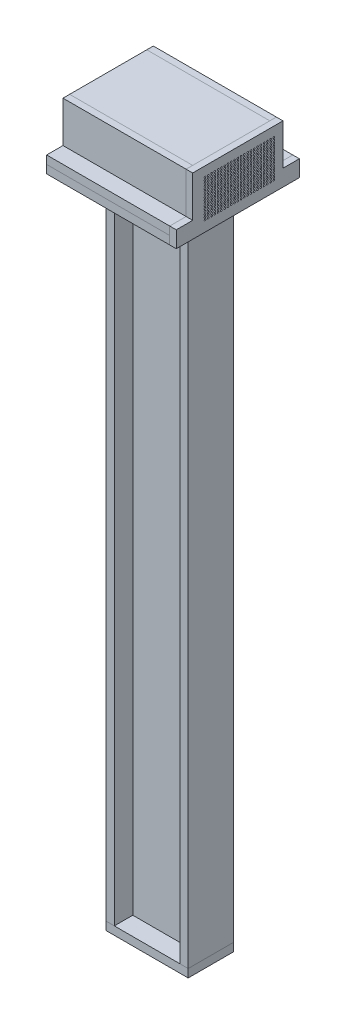
from build123d import *

# Parameters (mm, degrees)
SKETCH1_W             = 100
SKETCH1_H             = 55
BOSS_EXTRUDE1_DEPTH   = 10
BOSS_EXTRUDE2_DEPTH   = 800
SKETCH3_W             = 150
SKETCH3_H             = 150
BOSS_EXTRUDE3_DEPTH   = 10
SKETCH4_W             = 150
SKETCH4_H             = 20
BOSS_EXTRUDE4_DEPTH   = 10
BOSS_EXTRUDE4_2_DEPTH = 10
SKETCH5_W             = 150
SKETCH5_H             = 8
BOSS_EXTRUDE5_DEPTH   = 60
BOSS_EXTRUDE5_2_DEPTH = 60
BOSS_EXTRUDE6_REACH   = 899.167
SKETCH6_W             = 150
SKETCH6_H             = 8
BOSS_EXTRUDE7_DEPTH   = 8
BOSS_EXTRUDE8_DEPTH   = 94
SKETCH8_R             = 1
CUT_EXTRUDE2_DEPTH    = 8
SKETCH11_R            = 17.5
BOSS_EXTRUDE9_DEPTH   = 10
SKETCH12_R            = 15.5
CUT_EXTRUDE3_DEPTH    = 40


with BuildPart() as part:
    # Sketch1 → Boss-Extrude1 (new body)
    with BuildSketch(Plane(origin=(0, 0, 0), x_dir=(1, 0, 0), z_dir=(0, 1, 0))):
        with Locations((50, 27.5)):
            Rectangle(SKETCH1_W, SKETCH1_H)
    extrude(amount=BOSS_EXTRUDE1_DEPTH)


with BuildPart() as body_2:
    # Sketch2 → Boss-Extrude2 (new body)
    with BuildSketch(Plane(origin=(0, 10, 0), x_dir=(1, 0, 0), z_dir=(0, 1, 0))):
        Polygon((10, 55), (10, 32.5), (90, 32.5), (90, 55), (100, 55), (100, 0), (90, 0), (90, 22.5), (10, 22.5), (10, 0), (0, 0), (0, 55), align=None)
    extrude(amount=BOSS_EXTRUDE2_DEPTH)


with BuildPart() as body_3:
    # Sketch3 → Boss-Extrude3 (new body)
    with BuildSketch(Plane(origin=(0, 810, 0), x_dir=(1, 0, 0), z_dir=(0, 1, 0))):
        with Locations((50, 27.5)):
            Rectangle(SKETCH3_W, SKETCH3_H)
    extrude(amount=BOSS_EXTRUDE3_DEPTH)


with BuildPart() as body_4:
    # Sketch4 → Boss-Extrude4 (new body)
    with BuildSketch(Plane(origin=(0, 820, 0), x_dir=(1, 0, 0), z_dir=(0, 1, 0))):
        with Locations((50, 92.5)):
            Rectangle(SKETCH4_W, SKETCH4_H)
    extrude(amount=BOSS_EXTRUDE4_DEPTH)


with BuildPart() as body_5:
    # Sketch4 → Boss-Extrude4 2 (new body)
    with BuildSketch(Plane(origin=(0, 820, 0), x_dir=(1, 0, 0), z_dir=(0, 1, 0))):
        with Locations((50, -37.5)):
            Rectangle(SKETCH4_W, SKETCH4_H)
    extrude(amount=BOSS_EXTRUDE4_2_DEPTH)


with BuildPart() as body_6:
    # Sketch5 → Boss-Extrude5 (new body)
    with BuildSketch(Plane(origin=(0, 820, 0), x_dir=(1, 0, 0), z_dir=(0, 1, 0))):
        with Locations((50, 78.5)):
            Rectangle(SKETCH5_W, SKETCH5_H)
    extrude(amount=BOSS_EXTRUDE5_DEPTH)


with BuildPart() as body_7:
    # Sketch5 → Boss-Extrude5 2 (new body)
    with BuildSketch(Plane(origin=(0, 820, 0), x_dir=(1, 0, 0), z_dir=(0, 1, 0))):
        Polygon((-25, -19.5), (125, -19.5), (125, -27.5), (-25, -27.620297827), align=None)
    extrude(amount=BOSS_EXTRUDE5_2_DEPTH)


with BuildPart() as body_8:

    # Sketch6 → Boss-Extrude6 (new, up to next)
    with BuildSketch(Plane.XY.offset(-74.5), mode=Mode.PRIVATE) as boss_extrude6_sk1:
        with Locations((50, 876)):
            Rectangle(SKETCH6_W, SKETCH6_H)
    boss_extrude6_tool1 = extrude(boss_extrude6_sk1.sketch, amount=BOSS_EXTRUDE6_REACH, mode=Mode.PRIVATE) - body_7.part
    add(boss_extrude6_tool1.solids().sort_by_distance((50, 876, -74.5))[0])


with BuildPart() as body_9:
    # Sketch7 → Boss-Extrude7 (new body)
    with BuildSketch(Plane(origin=(125, 0, 0), x_dir=(0, 0, -1), z_dir=(1, 0, 0))):
        Polygon((-47.5, 810), (-47.5, 830), (-27.5, 830), (-27.5, 880), (82.5, 880), (82.5, 830), (102.5, 830), (102.5, 810), align=None)
    extrude(amount=BOSS_EXTRUDE7_DEPTH)

    # Sketch8 → Cut-Extrude2 (cut)
    with BuildSketch(Plane(origin=(133, 0, 0), x_dir=(0, 0, -1), z_dir=(1, 0, 0))):
        with Locations((-12.5, 868)):
            Circle(SKETCH8_R)
        with Locations((-8.5, 868)):
            Circle(SKETCH8_R)
        with Locations((-4.5, 868)):
            Circle(SKETCH8_R)
        with Locations((-0.5, 868)):
            Circle(SKETCH8_R)
        with Locations((3.5, 868)):
            Circle(SKETCH8_R)
        with Locations((7.5, 868)):
            Circle(SKETCH8_R)
        with Locations((11.5, 868)):
            Circle(SKETCH8_R)
        with Locations((15.5, 868)):
            Circle(SKETCH8_R)
        with Locations((19.5, 868)):
            Circle(SKETCH8_R)
        with Locations((23.5, 868)):
            Circle(SKETCH8_R)
        with Locations((27.5, 868)):
            Circle(SKETCH8_R)
        with Locations((31.5, 868)):
            Circle(SKETCH8_R)
        with Locations((35.5, 868)):
            Circle(SKETCH8_R)
        with Locations((39.5, 868)):
            Circle(SKETCH8_R)
        with Locations((43.5, 868)):
            Circle(SKETCH8_R)
        with Locations((47.5, 868)):
            Circle(SKETCH8_R)
        with Locations((51.5, 868)):
            Circle(SKETCH8_R)
        with Locations((55.5, 868)):
            Circle(SKETCH8_R)
        with Locations((59.5, 868)):
            Circle(SKETCH8_R)
        with Locations((63.5, 868)):
            Circle(SKETCH8_R)
        with Locations((67.5, 868)):
            Circle(SKETCH8_R)
        with Locations((71.5, 868)):
            Circle(SKETCH8_R)
        with Locations((-8.5, 865)):
            Circle(SKETCH8_R)
        with Locations((-4.5, 865)):
            Circle(SKETCH8_R)
        with Locations((-0.5, 865)):
            Circle(SKETCH8_R)
        with Locations((3.5, 865)):
            Circle(SKETCH8_R)
        with Locations((7.5, 865)):
            Circle(SKETCH8_R)
        with Locations((11.5, 865)):
            Circle(SKETCH8_R)
        with Locations((15.5, 865)):
            Circle(SKETCH8_R)
        with Locations((19.5, 865)):
            Circle(SKETCH8_R)
        with Locations((23.5, 865)):
            Circle(SKETCH8_R)
        with Locations((27.5, 865)):
            Circle(SKETCH8_R)
        with Locations((31.5, 865)):
            Circle(SKETCH8_R)
        with Locations((35.5, 865)):
            Circle(SKETCH8_R)
        with Locations((39.5, 865)):
            Circle(SKETCH8_R)
        with Locations((43.5, 865)):
            Circle(SKETCH8_R)
        with Locations((47.5, 865)):
            Circle(SKETCH8_R)
        with Locations((51.5, 865)):
            Circle(SKETCH8_R)
        with Locations((55.5, 865)):
            Circle(SKETCH8_R)
        with Locations((59.5, 865)):
            Circle(SKETCH8_R)
        with Locations((63.5, 865)):
            Circle(SKETCH8_R)
        with Locations((67.5, 865)):
            Circle(SKETCH8_R)
        with Locations((71.5, 865)):
            Circle(SKETCH8_R)
        with Locations((-8.5, 862)):
            Circle(SKETCH8_R)
        with Locations((-4.5, 862)):
            Circle(SKETCH8_R)
        with Locations((-0.5, 862)):
            Circle(SKETCH8_R)
        with Locations((3.5, 862)):
            Circle(SKETCH8_R)
        with Locations((7.5, 862)):
            Circle(SKETCH8_R)
        with Locations((11.5, 862)):
            Circle(SKETCH8_R)
        with Locations((15.5, 862)):
            Circle(SKETCH8_R)
        with Locations((19.5, 862)):
            Circle(SKETCH8_R)
        with Locations((23.5, 862)):
            Circle(SKETCH8_R)
        with Locations((27.5, 862)):
            Circle(SKETCH8_R)
        with Locations((31.5, 862)):
            Circle(SKETCH8_R)
        with Locations((35.5, 862)):
            Circle(SKETCH8_R)
        with Locations((39.5, 862)):
            Circle(SKETCH8_R)
        with Locations((43.5, 862)):
            Circle(SKETCH8_R)
        with Locations((47.5, 862)):
            Circle(SKETCH8_R)
        with Locations((51.5, 862)):
            Circle(SKETCH8_R)
        with Locations((55.5, 862)):
            Circle(SKETCH8_R)
        with Locations((59.5, 862)):
            Circle(SKETCH8_R)
        with Locations((63.5, 862)):
            Circle(SKETCH8_R)
        with Locations((67.5, 862)):
            Circle(SKETCH8_R)
        with Locations((71.5, 862)):
            Circle(SKETCH8_R)
        with Locations((-8.5, 859)):
            Circle(SKETCH8_R)
        with Locations((-4.5, 859)):
            Circle(SKETCH8_R)
        with Locations((-0.5, 859)):
            Circle(SKETCH8_R)
        with Locations((3.5, 859)):
            Circle(SKETCH8_R)
        with Locations((7.5, 859)):
            Circle(SKETCH8_R)
        with Locations((11.5, 859)):
            Circle(SKETCH8_R)
        with Locations((15.5, 859)):
            Circle(SKETCH8_R)
        with Locations((19.5, 859)):
            Circle(SKETCH8_R)
        with Locations((23.5, 859)):
            Circle(SKETCH8_R)
        with Locations((27.5, 859)):
            Circle(SKETCH8_R)
        with Locations((31.5, 859)):
            Circle(SKETCH8_R)
        with Locations((35.5, 859)):
            Circle(SKETCH8_R)
        with Locations((39.5, 859)):
            Circle(SKETCH8_R)
        with Locations((43.5, 859)):
            Circle(SKETCH8_R)
        with Locations((47.5, 859)):
            Circle(SKETCH8_R)
        with Locations((51.5, 859)):
            Circle(SKETCH8_R)
        with Locations((55.5, 859)):
            Circle(SKETCH8_R)
        with Locations((59.5, 859)):
            Circle(SKETCH8_R)
        with Locations((63.5, 859)):
            Circle(SKETCH8_R)
        with Locations((67.5, 859)):
            Circle(SKETCH8_R)
        with Locations((71.5, 859)):
            Circle(SKETCH8_R)
        with Locations((-8.5, 856)):
            Circle(SKETCH8_R)
        with Locations((-4.5, 856)):
            Circle(SKETCH8_R)
        with Locations((-0.5, 856)):
            Circle(SKETCH8_R)
        with Locations((3.5, 856)):
            Circle(SKETCH8_R)
        with Locations((7.5, 856)):
            Circle(SKETCH8_R)
        with Locations((11.5, 856)):
            Circle(SKETCH8_R)
        with Locations((15.5, 856)):
            Circle(SKETCH8_R)
        with Locations((19.5, 856)):
            Circle(SKETCH8_R)
        with Locations((23.5, 856)):
            Circle(SKETCH8_R)
        with Locations((27.5, 856)):
            Circle(SKETCH8_R)
        with Locations((31.5, 856)):
            Circle(SKETCH8_R)
        with Locations((35.5, 856)):
            Circle(SKETCH8_R)
        with Locations((39.5, 856)):
            Circle(SKETCH8_R)
        with Locations((43.5, 856)):
            Circle(SKETCH8_R)
        with Locations((47.5, 856)):
            Circle(SKETCH8_R)
        with Locations((51.5, 856)):
            Circle(SKETCH8_R)
        with Locations((55.5, 856)):
            Circle(SKETCH8_R)
        with Locations((59.5, 856)):
            Circle(SKETCH8_R)
        with Locations((63.5, 856)):
            Circle(SKETCH8_R)
        with Locations((67.5, 856)):
            Circle(SKETCH8_R)
        with Locations((71.5, 856)):
            Circle(SKETCH8_R)
        with Locations((-8.5, 853)):
            Circle(SKETCH8_R)
        with Locations((-4.5, 853)):
            Circle(SKETCH8_R)
        with Locations((-0.5, 853)):
            Circle(SKETCH8_R)
        with Locations((3.5, 853)):
            Circle(SKETCH8_R)
        with Locations((7.5, 853)):
            Circle(SKETCH8_R)
        with Locations((11.5, 853)):
            Circle(SKETCH8_R)
        with Locations((15.5, 853)):
            Circle(SKETCH8_R)
        with Locations((19.5, 853)):
            Circle(SKETCH8_R)
        with Locations((23.5, 853)):
            Circle(SKETCH8_R)
        with Locations((27.5, 853)):
            Circle(SKETCH8_R)
        with Locations((31.5, 853)):
            Circle(SKETCH8_R)
        with Locations((35.5, 853)):
            Circle(SKETCH8_R)
        with Locations((39.5, 853)):
            Circle(SKETCH8_R)
        with Locations((43.5, 853)):
            Circle(SKETCH8_R)
        with Locations((47.5, 853)):
            Circle(SKETCH8_R)
        with Locations((51.5, 853)):
            Circle(SKETCH8_R)
        with Locations((55.5, 853)):
            Circle(SKETCH8_R)
        with Locations((59.5, 853)):
            Circle(SKETCH8_R)
        with Locations((63.5, 853)):
            Circle(SKETCH8_R)
        with Locations((67.5, 853)):
            Circle(SKETCH8_R)
        with Locations((71.5, 853)):
            Circle(SKETCH8_R)
        with Locations((-8.5, 850)):
            Circle(SKETCH8_R)
        with Locations((-4.5, 850)):
            Circle(SKETCH8_R)
        with Locations((-0.5, 850)):
            Circle(SKETCH8_R)
        with Locations((3.5, 850)):
            Circle(SKETCH8_R)
        with Locations((7.5, 850)):
            Circle(SKETCH8_R)
        with Locations((11.5, 850)):
            Circle(SKETCH8_R)
        with Locations((15.5, 850)):
            Circle(SKETCH8_R)
        with Locations((19.5, 850)):
            Circle(SKETCH8_R)
        with Locations((23.5, 850)):
            Circle(SKETCH8_R)
        with Locations((27.5, 850)):
            Circle(SKETCH8_R)
        with Locations((31.5, 850)):
            Circle(SKETCH8_R)
        with Locations((35.5, 850)):
            Circle(SKETCH8_R)
        with Locations((39.5, 850)):
            Circle(SKETCH8_R)
        with Locations((43.5, 850)):
            Circle(SKETCH8_R)
        with Locations((47.5, 850)):
            Circle(SKETCH8_R)
        with Locations((51.5, 850)):
            Circle(SKETCH8_R)
        with Locations((55.5, 850)):
            Circle(SKETCH8_R)
        with Locations((59.5, 850)):
            Circle(SKETCH8_R)
        with Locations((63.5, 850)):
            Circle(SKETCH8_R)
        with Locations((67.5, 850)):
            Circle(SKETCH8_R)
        with Locations((71.5, 850)):
            Circle(SKETCH8_R)
        with Locations((-8.5, 847)):
            Circle(SKETCH8_R)
        with Locations((-4.5, 847)):
            Circle(SKETCH8_R)
        with Locations((-0.5, 847)):
            Circle(SKETCH8_R)
        with Locations((3.5, 847)):
            Circle(SKETCH8_R)
        with Locations((7.5, 847)):
            Circle(SKETCH8_R)
        with Locations((11.5, 847)):
            Circle(SKETCH8_R)
        with Locations((15.5, 847)):
            Circle(SKETCH8_R)
        with Locations((19.5, 847)):
            Circle(SKETCH8_R)
        with Locations((23.5, 847)):
            Circle(SKETCH8_R)
        with Locations((27.5, 847)):
            Circle(SKETCH8_R)
        with Locations((31.5, 847)):
            Circle(SKETCH8_R)
        with Locations((35.5, 847)):
            Circle(SKETCH8_R)
        with Locations((39.5, 847)):
            Circle(SKETCH8_R)
        with Locations((43.5, 847)):
            Circle(SKETCH8_R)
        with Locations((47.5, 847)):
            Circle(SKETCH8_R)
        with Locations((51.5, 847)):
            Circle(SKETCH8_R)
        with Locations((55.5, 847)):
            Circle(SKETCH8_R)
        with Locations((59.5, 847)):
            Circle(SKETCH8_R)
        with Locations((63.5, 847)):
            Circle(SKETCH8_R)
        with Locations((67.5, 847)):
            Circle(SKETCH8_R)
        with Locations((71.5, 847)):
            Circle(SKETCH8_R)
        with Locations((-8.5, 844)):
            Circle(SKETCH8_R)
        with Locations((-4.5, 844)):
            Circle(SKETCH8_R)
        with Locations((-0.5, 844)):
            Circle(SKETCH8_R)
        with Locations((3.5, 844)):
            Circle(SKETCH8_R)
        with Locations((7.5, 844)):
            Circle(SKETCH8_R)
        with Locations((11.5, 844)):
            Circle(SKETCH8_R)
        with Locations((15.5, 844)):
            Circle(SKETCH8_R)
        with Locations((19.5, 844)):
            Circle(SKETCH8_R)
        with Locations((23.5, 844)):
            Circle(SKETCH8_R)
        with Locations((27.5, 844)):
            Circle(SKETCH8_R)
        with Locations((31.5, 844)):
            Circle(SKETCH8_R)
        with Locations((35.5, 844)):
            Circle(SKETCH8_R)
        with Locations((39.5, 844)):
            Circle(SKETCH8_R)
        with Locations((43.5, 844)):
            Circle(SKETCH8_R)
        with Locations((47.5, 844)):
            Circle(SKETCH8_R)
        with Locations((51.5, 844)):
            Circle(SKETCH8_R)
        with Locations((55.5, 844)):
            Circle(SKETCH8_R)
        with Locations((59.5, 844)):
            Circle(SKETCH8_R)
        with Locations((63.5, 844)):
            Circle(SKETCH8_R)
        with Locations((67.5, 844)):
            Circle(SKETCH8_R)
        with Locations((71.5, 844)):
            Circle(SKETCH8_R)
        with Locations((-8.5, 841)):
            Circle(SKETCH8_R)
        with Locations((-4.5, 841)):
            Circle(SKETCH8_R)
        with Locations((-0.5, 841)):
            Circle(SKETCH8_R)
        with Locations((3.5, 841)):
            Circle(SKETCH8_R)
        with Locations((7.5, 841)):
            Circle(SKETCH8_R)
        with Locations((11.5, 841)):
            Circle(SKETCH8_R)
        with Locations((15.5, 841)):
            Circle(SKETCH8_R)
        with Locations((19.5, 841)):
            Circle(SKETCH8_R)
        with Locations((23.5, 841)):
            Circle(SKETCH8_R)
        with Locations((27.5, 841)):
            Circle(SKETCH8_R)
        with Locations((31.5, 841)):
            Circle(SKETCH8_R)
        with Locations((35.5, 841)):
            Circle(SKETCH8_R)
        with Locations((39.5, 841)):
            Circle(SKETCH8_R)
        with Locations((43.5, 841)):
            Circle(SKETCH8_R)
        with Locations((47.5, 841)):
            Circle(SKETCH8_R)
        with Locations((51.5, 841)):
            Circle(SKETCH8_R)
        with Locations((55.5, 841)):
            Circle(SKETCH8_R)
        with Locations((59.5, 841)):
            Circle(SKETCH8_R)
        with Locations((63.5, 841)):
            Circle(SKETCH8_R)
        with Locations((67.5, 841)):
            Circle(SKETCH8_R)
        with Locations((71.5, 841)):
            Circle(SKETCH8_R)
        with Locations((-8.5, 838)):
            Circle(SKETCH8_R)
        with Locations((-4.5, 838)):
            Circle(SKETCH8_R)
        with Locations((-0.5, 838)):
            Circle(SKETCH8_R)
        with Locations((3.5, 838)):
            Circle(SKETCH8_R)
        with Locations((7.5, 838)):
            Circle(SKETCH8_R)
        with Locations((11.5, 838)):
            Circle(SKETCH8_R)
        with Locations((15.5, 838)):
            Circle(SKETCH8_R)
        with Locations((19.5, 838)):
            Circle(SKETCH8_R)
        with Locations((23.5, 838)):
            Circle(SKETCH8_R)
        with Locations((27.5, 838)):
            Circle(SKETCH8_R)
        with Locations((31.5, 838)):
            Circle(SKETCH8_R)
        with Locations((35.5, 838)):
            Circle(SKETCH8_R)
        with Locations((39.5, 838)):
            Circle(SKETCH8_R)
        with Locations((43.5, 838)):
            Circle(SKETCH8_R)
        with Locations((47.5, 838)):
            Circle(SKETCH8_R)
        with Locations((51.5, 838)):
            Circle(SKETCH8_R)
        with Locations((55.5, 838)):
            Circle(SKETCH8_R)
        with Locations((59.5, 838)):
            Circle(SKETCH8_R)
        with Locations((63.5, 838)):
            Circle(SKETCH8_R)
        with Locations((67.5, 838)):
            Circle(SKETCH8_R)
        with Locations((71.5, 838)):
            Circle(SKETCH8_R)
        with Locations((-8.5, 835)):
            Circle(SKETCH8_R)
        with Locations((-4.5, 835)):
            Circle(SKETCH8_R)
        with Locations((-0.5, 835)):
            Circle(SKETCH8_R)
        with Locations((3.5, 835)):
            Circle(SKETCH8_R)
        with Locations((7.5, 835)):
            Circle(SKETCH8_R)
        with Locations((11.5, 835)):
            Circle(SKETCH8_R)
        with Locations((15.5, 835)):
            Circle(SKETCH8_R)
        with Locations((19.5, 835)):
            Circle(SKETCH8_R)
        with Locations((23.5, 835)):
            Circle(SKETCH8_R)
        with Locations((27.5, 835)):
            Circle(SKETCH8_R)
        with Locations((31.5, 835)):
            Circle(SKETCH8_R)
        with Locations((35.5, 835)):
            Circle(SKETCH8_R)
        with Locations((39.5, 835)):
            Circle(SKETCH8_R)
        with Locations((43.5, 835)):
            Circle(SKETCH8_R)
        with Locations((47.5, 835)):
            Circle(SKETCH8_R)
        with Locations((51.5, 835)):
            Circle(SKETCH8_R)
        with Locations((55.5, 835)):
            Circle(SKETCH8_R)
        with Locations((59.5, 835)):
            Circle(SKETCH8_R)
        with Locations((63.5, 835)):
            Circle(SKETCH8_R)
        with Locations((67.5, 835)):
            Circle(SKETCH8_R)
        with Locations((71.5, 835)):
            Circle(SKETCH8_R)
        with Locations((-8.5, 832)):
            Circle(SKETCH8_R)
        with Locations((-4.5, 832)):
            Circle(SKETCH8_R)
        with Locations((-0.5, 832)):
            Circle(SKETCH8_R)
        with Locations((3.5, 832)):
            Circle(SKETCH8_R)
        with Locations((7.5, 832)):
            Circle(SKETCH8_R)
        with Locations((11.5, 832)):
            Circle(SKETCH8_R)
        with Locations((15.5, 832)):
            Circle(SKETCH8_R)
        with Locations((19.5, 832)):
            Circle(SKETCH8_R)
        with Locations((23.5, 832)):
            Circle(SKETCH8_R)
        with Locations((27.5, 832)):
            Circle(SKETCH8_R)
        with Locations((31.5, 832)):
            Circle(SKETCH8_R)
        with Locations((35.5, 832)):
            Circle(SKETCH8_R)
        with Locations((39.5, 832)):
            Circle(SKETCH8_R)
        with Locations((43.5, 832)):
            Circle(SKETCH8_R)
        with Locations((47.5, 832)):
            Circle(SKETCH8_R)
        with Locations((51.5, 832)):
            Circle(SKETCH8_R)
        with Locations((55.5, 832)):
            Circle(SKETCH8_R)
        with Locations((59.5, 832)):
            Circle(SKETCH8_R)
        with Locations((63.5, 832)):
            Circle(SKETCH8_R)
        with Locations((67.5, 832)):
            Circle(SKETCH8_R)
        with Locations((71.5, 832)):
            Circle(SKETCH8_R)
        with Locations((-8.5, 829)):
            Circle(SKETCH8_R)
        with Locations((-4.5, 829)):
            Circle(SKETCH8_R)
        with Locations((-0.5, 829)):
            Circle(SKETCH8_R)
        with Locations((3.5, 829)):
            Circle(SKETCH8_R)
        with Locations((7.5, 829)):
            Circle(SKETCH8_R)
        with Locations((11.5, 829)):
            Circle(SKETCH8_R)
        with Locations((15.5, 829)):
            Circle(SKETCH8_R)
        with Locations((19.5, 829)):
            Circle(SKETCH8_R)
        with Locations((23.5, 829)):
            Circle(SKETCH8_R)
        with Locations((27.5, 829)):
            Circle(SKETCH8_R)
        with Locations((31.5, 829)):
            Circle(SKETCH8_R)
        with Locations((35.5, 829)):
            Circle(SKETCH8_R)
        with Locations((39.5, 829)):
            Circle(SKETCH8_R)
        with Locations((43.5, 829)):
            Circle(SKETCH8_R)
        with Locations((47.5, 829)):
            Circle(SKETCH8_R)
        with Locations((51.5, 829)):
            Circle(SKETCH8_R)
        with Locations((55.5, 829)):
            Circle(SKETCH8_R)
        with Locations((59.5, 829)):
            Circle(SKETCH8_R)
        with Locations((63.5, 829)):
            Circle(SKETCH8_R)
        with Locations((67.5, 829)):
            Circle(SKETCH8_R)
        with Locations((71.5, 829)):
            Circle(SKETCH8_R)
        with Locations((-8.5, 826)):
            Circle(SKETCH8_R)
        with Locations((-4.5, 826)):
            Circle(SKETCH8_R)
        with Locations((-0.5, 826)):
            Circle(SKETCH8_R)
        with Locations((3.5, 826)):
            Circle(SKETCH8_R)
        with Locations((7.5, 826)):
            Circle(SKETCH8_R)
        with Locations((11.5, 826)):
            Circle(SKETCH8_R)
        with Locations((15.5, 826)):
            Circle(SKETCH8_R)
        with Locations((19.5, 826)):
            Circle(SKETCH8_R)
        with Locations((23.5, 826)):
            Circle(SKETCH8_R)
        with Locations((27.5, 826)):
            Circle(SKETCH8_R)
        with Locations((31.5, 826)):
            Circle(SKETCH8_R)
        with Locations((35.5, 826)):
            Circle(SKETCH8_R)
        with Locations((39.5, 826)):
            Circle(SKETCH8_R)
        with Locations((43.5, 826)):
            Circle(SKETCH8_R)
        with Locations((47.5, 826)):
            Circle(SKETCH8_R)
        with Locations((51.5, 826)):
            Circle(SKETCH8_R)
        with Locations((55.5, 826)):
            Circle(SKETCH8_R)
        with Locations((59.5, 826)):
            Circle(SKETCH8_R)
        with Locations((63.5, 826)):
            Circle(SKETCH8_R)
        with Locations((67.5, 826)):
            Circle(SKETCH8_R)
        with Locations((71.5, 826)):
            Circle(SKETCH8_R)
        with Locations((-8.5, 823)):
            Circle(SKETCH8_R)
        with Locations((-4.5, 823)):
            Circle(SKETCH8_R)
        with Locations((-0.5, 823)):
            Circle(SKETCH8_R)
        with Locations((3.5, 823)):
            Circle(SKETCH8_R)
        with Locations((7.5, 823)):
            Circle(SKETCH8_R)
        with Locations((11.5, 823)):
            Circle(SKETCH8_R)
        with Locations((15.5, 823)):
            Circle(SKETCH8_R)
        with Locations((19.5, 823)):
            Circle(SKETCH8_R)
        with Locations((23.5, 823)):
            Circle(SKETCH8_R)
        with Locations((27.5, 823)):
            Circle(SKETCH8_R)
        with Locations((31.5, 823)):
            Circle(SKETCH8_R)
        with Locations((35.5, 823)):
            Circle(SKETCH8_R)
        with Locations((39.5, 823)):
            Circle(SKETCH8_R)
        with Locations((43.5, 823)):
            Circle(SKETCH8_R)
        with Locations((47.5, 823)):
            Circle(SKETCH8_R)
        with Locations((51.5, 823)):
            Circle(SKETCH8_R)
        with Locations((55.5, 823)):
            Circle(SKETCH8_R)
        with Locations((59.5, 823)):
            Circle(SKETCH8_R)
        with Locations((63.5, 823)):
            Circle(SKETCH8_R)
        with Locations((67.5, 823)):
            Circle(SKETCH8_R)
        with Locations((71.5, 823)):
            Circle(SKETCH8_R)
        with Locations((-12.5, 865)):
            Circle(SKETCH8_R)
        with Locations((-12.5, 862)):
            Circle(SKETCH8_R)
        with Locations((-12.5, 859)):
            Circle(SKETCH8_R)
        with Locations((-12.5, 856)):
            Circle(SKETCH8_R)
        with Locations((-12.5, 853)):
            Circle(SKETCH8_R)
        with Locations((-12.5, 850)):
            Circle(SKETCH8_R)
        with Locations((-12.5, 847)):
            Circle(SKETCH8_R)
        with Locations((-12.5, 844)):
            Circle(SKETCH8_R)
        with Locations((-12.5, 841)):
            Circle(SKETCH8_R)
        with Locations((-12.5, 838)):
            Circle(SKETCH8_R)
        with Locations((-12.5, 835)):
            Circle(SKETCH8_R)
        with Locations((-12.5, 832)):
            Circle(SKETCH8_R)
        with Locations((-12.5, 829)):
            Circle(SKETCH8_R)
        with Locations((-12.5, 826)):
            Circle(SKETCH8_R)
        with Locations((-12.5, 823)):
            Circle(SKETCH8_R)
    extrude(amount=-CUT_EXTRUDE2_DEPTH, mode=Mode.SUBTRACT)


with BuildPart() as body_10:
    # Sketch9 → Boss-Extrude8 (new body)
    with BuildSketch(Plane.XY.offset(-74.5)):
        Polygon((-17, 871.750858151), (-17, 820), (-25, 820), (-25, 872), align=None)
    extrude(amount=BOSS_EXTRUDE8_DEPTH)


with BuildPart() as body_11:
    # Sketch11 → Boss-Extrude9 (new body)
    with BuildSketch(Plane.ZY.offset(25)):
        with Locations((-27.5, 846)):
            Circle(SKETCH11_R)
    extrude(amount=BOSS_EXTRUDE9_DEPTH)


with BuildPart() as cut_extrude3_tool:
    # Sketch12 → Cut-Extrude3 (new body)
    with BuildSketch(Plane.ZY.offset(35)):
        with Locations((-27.5, 846)):
            Circle(SKETCH12_R)
    extrude(amount=-CUT_EXTRUDE3_DEPTH)


with BuildPart() as body_10_1:
    add(body_10.part)

    # Cut-Extrude3: cut by cut_extrude3_tool
    add(cut_extrude3_tool.part, mode=Mode.SUBTRACT)


with BuildPart() as body_11_1:
    add(body_11.part)

    # Cut-Extrude3: cut by cut_extrude3_tool
    add(cut_extrude3_tool.part, mode=Mode.SUBTRACT)


solid = Compound([part.part, body_2.part, body_3.part, body_4.part, body_5.part, body_6.part, body_7.part, body_8.part, body_9.part, body_10_1.part, body_11_1.part])
